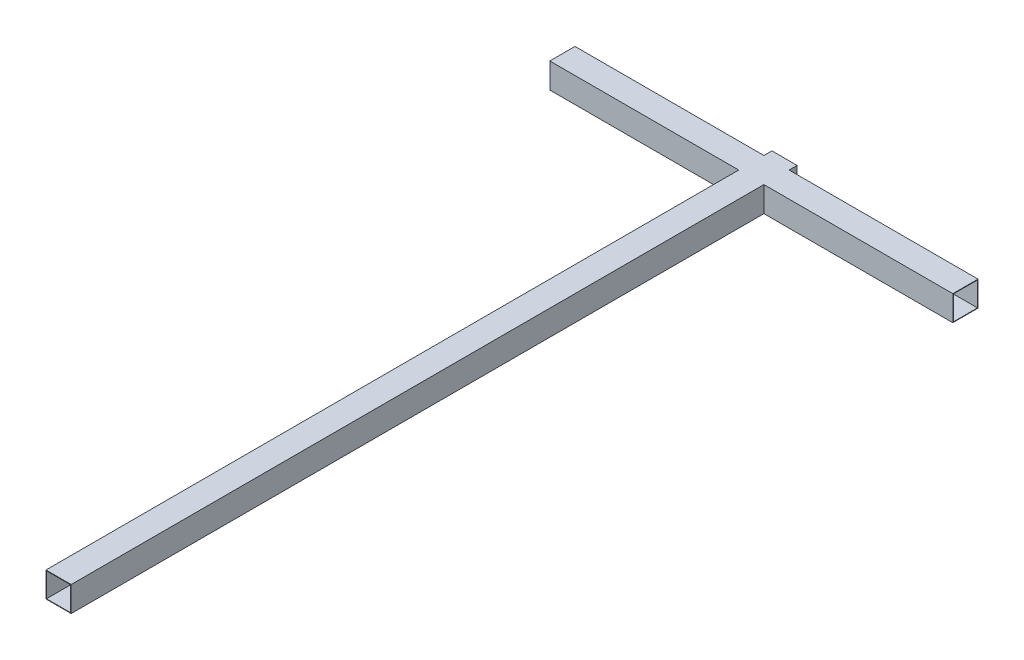
from build123d import *

# Parameters (mm, degrees)
FWD_AFT_BEAM_XS_W   = 50
FWD_AFT_BEAM_XS_H   = 50
FWD_AFT_BEAM_XS_W_2 = 48
FWD_AFT_BEAM_XS_H_2 = 48
LAT_BEAM_XS_W       = 50
LAT_BEAM_XS_H       = 50
LAT_BEAM_XS_W_2     = 48
LAT_BEAM_XS_H_2     = 48


with BuildPart() as part:
    # fwd-aft-beam: sweep along a path in fwd-aft-beam-profile
    with BuildLine(Plane(origin=(0, 250, -250), x_dir=(1, 0, 0), z_dir=(0, -1, 0))) as fwd_aft_beam_path:
        Line((0, 1550), (0, 109.08012585))
    # fwd-aft-beam-xs → fwd-aft-beam (sweep)
    with BuildSketch(Plane.XY):
        with Locations((0, 250)):
            Rectangle(FWD_AFT_BEAM_XS_W, FWD_AFT_BEAM_XS_H)
        with Locations((0, 250)):
            Rectangle(FWD_AFT_BEAM_XS_W_2, FWD_AFT_BEAM_XS_H_2, mode=Mode.SUBTRACT)
    sweep(path=fwd_aft_beam_path.line)

    # lat-beam: sweep along a path in lat-beam-profile
    with BuildLine(Plane(origin=(0, 250, 0), x_dir=(1, 0, 0), z_dir=(0, 1, 0))) as lat_beam_path:
        Line((-400, 100), (400, 100))
    # lat-beam-xs → lat-beam (sweep)
    with BuildSketch(Plane(origin=(0, 0, 0), x_dir=(0, 0, -1), z_dir=(1, 0, 0))):
        with Locations((100, 250)):
            Rectangle(LAT_BEAM_XS_W, LAT_BEAM_XS_H)
        with Locations((100, 250)):
            Rectangle(LAT_BEAM_XS_W_2, LAT_BEAM_XS_H_2, mode=Mode.SUBTRACT)
    sweep(path=lat_beam_path.line)


solid = part.part
